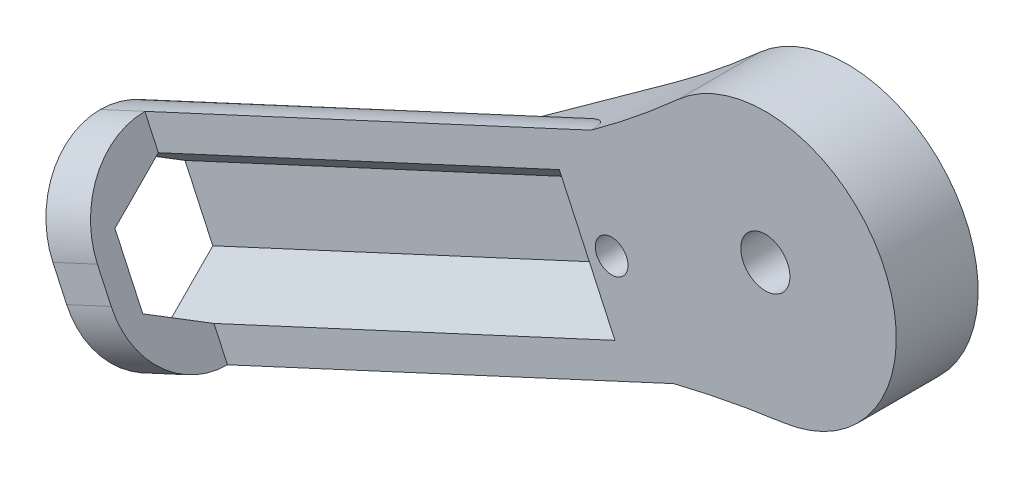
from build123d import *

# Parameters (mm, degrees)
ESQUISSE1_R             = 1.5
ESQUISSE1_R_2           = 1
BOSS_EXTRU_1_DEPTH      = 5
ENL_V_MAT_EXTRU_1_DEPTH = 5
ESQUISSE5_W             = 5
ESQUISSE5_H             = 12
BOSS_EXTRU_2_DEPTH      = 30
CONG_3_START            = -20.022088667
CONG_3_DEPTH            = 7.142932423
CONG_3_START_2          = -12.879156244
CONG_3_2_DEPTH          = 25.906077345
CONG_3_3_OUTLINE_R      = 1
CONG_3_3_OUTLINE_R_2    = 1.5
CONG_3_3_DEPTH          = 5
CONG_4_START            = -20.022088667
CONG_4_DEPTH            = 30
CONG_4_2_DEPTH          = 7.14293242
CONG_4_START_2          = -12.879156247
CONG_4_3_DEPTH          = 25.906077346
CONG_4_4_OUTLINE_R      = 1
CONG_4_4_OUTLINE_R_2    = 1.5
CONG_4_4_DEPTH          = 5
ENL_V_START             = -27
ENL_V_MAT_EXTRU_2_DEPTH = 27
ENL_V_MAT_EXTRU_3_DEPTH = 30


with BuildPart() as part:
    # Esquisse1 → Boss.-Extru.1 (new body)
    with BuildSketch(Plane.XY):
        with BuildLine():
            Line((-22.897983435, -17.234182679), (14.345633901, 0.026586982))
            add(Edge.make_bspline(
                [(14.345633901, 0.026586982), (16.492281726, 0.559482648), (18.723148816, 0.988675042), (21.041646725, 1.309858226)],
                knots=[0, 0, 0, 0, 0.141370549, 0.141370549, 0.141370549, 0.141370549], degree=3))
            ThreePointArc((21.041646725, 1.309858226), (27.202255265, 12.598116604), (14.60702072, 15.193871131))
            add(Edge.make_bspline(
                [(14.60702072, 15.193871131), (12.863335774, 13.632412198), (11.093879733, 12.207631723), (9.299732983, 10.914143371)],
                knots=[0, 0, 0, 0, 0.141370549, 0.141370549, 0.141370549, 0.141370549], degree=3))
            Line((9.299732983, 10.914143371), (-27.943884355, -6.346626291))
            Line((-27.943884355, -6.346626291), (-22.897983435, -17.234182679))
        make_face()
        with Locations((19.943884355, 9.234182671)):
            Circle(ESQUISSE1_R, mode=Mode.SUBTRACT)
        with Locations((10.553366977, 4.882093131)):
            Circle(ESQUISSE1_R_2, mode=Mode.SUBTRACT)
    extrude(amount=BOSS_EXTRU_1_DEPTH)

    # Esquisse2 → Enlèv. mat.-Extru.1 (cut)
    with BuildSketch(Plane.XY.offset(5)):
        Polygon((-53.781292167, 9.271840667), (-26.364947587, 9.271840667), (-1.521431989, -44.333091582), (-53.781292167, -44.333091582), align=None)
    extrude(amount=-ENL_V_MAT_EXTRU_1_DEPTH, mode=Mode.SUBTRACT)

    # Esquisse5 → Boss.-Extru.2 (add)
    with BuildSketch(Plane(origin=(-18.165968268, -8.419122963, 0), x_dir=(0, 0, 1), z_dir=(-0.9072963650485315, -0.42049174304583187, 0))):
        with Locations((7.5, -0.008098332)):
            Rectangle(ESQUISSE5_W, ESQUISSE5_H)
    extrude(amount=-BOSS_EXTRU_2_DEPTH)

    # Congé3: read off the stored shape, not the designer's step
    # Congé3 outline → Congé3 (cut)
    with BuildSketch(Plane(origin=(0, 0, 0), x_dir=(-0.4204917430458318, 0.9072963650485315, 0), z_dir=(0.9072963650485315, 0.4204917430458318, 0)).offset(CONG_3_START)):
        with BuildLine():
            Line((5.991901676, 0), (5.991901676, 5))
            ThreePointArc((5.991901676, 5), (4.527435582, 1.464466094), (0.991901676, 0))
            Line((0.991901676, 0), (5.991901676, 0))
        make_face()
    extrude(amount=CONG_3_DEPTH, mode=Mode.SUBTRACT)

    # Cong_3 2 outline → Cong_3 2 (cut)
    with BuildSketch(Plane(origin=(0, 0, 0), x_dir=(-0.4204917430458318, 0.9072963650485315, 0), z_dir=(0.9072963650485315, 0.4204917430458318, 0)).offset(CONG_3_START_2)):
        with BuildLine():
            Line((5.991901676, 0), (5.991901676, 5))
            ThreePointArc((5.991901676, 5), (4.527435582, 1.464466094), (0.991901676, 0))
            Line((0.991901676, 0), (5.991901676, 0))
        make_face()
    extrude(amount=CONG_3_2_DEPTH, mode=Mode.SUBTRACT)

    # Cong_3 3 outline → Cong_3 3 (add)
    with BuildSketch(Plane.XY):
        with BuildLine():
            Line((-18.583054733, -7.519174178), (-15.639612528, -13.870248741))
            Line((-15.639612528, -13.870248741), (14.345633901, 0.026586982))
            add(Edge.make_bspline(
                [(14.345633901, 0.026586982), (16.492281726, 0.559482648), (18.723148816, 0.988675042), (21.041646725, 1.309858226)],
                knots=[0, 0, 0, 0, 0.141370549, 0.141370549, 0.141370549, 0.141370549], degree=3))
            ThreePointArc((21.041646725, 1.309858226), (27.202255265, 12.598116604), (14.60702072, 15.193871131))
            add(Edge.make_bspline(
                [(14.60702072, 15.193871131), (12.863335774, 13.632412198), (11.093879733, 12.207631723), (9.299732983, 10.914143371), (2.165722649, 5.77088557), (-4.968287685, 0.62762777), (-12.102298019, -4.515630031)],
                knots=[0, 0, 0, 0, 0.141370549, 0.141370549, 0.141370549, 0.703497896, 0.703497896, 0.703497896, 0.703497896], degree=3))
            Line((-12.102298019, -4.515630031), (-18.583054733, -7.519174178))
        make_face()
        with Locations((10.553366977, 4.882093131)):
            Circle(CONG_3_3_OUTLINE_R, mode=Mode.SUBTRACT)
        with Locations((19.943884355, 9.234182671)):
            Circle(CONG_3_3_OUTLINE_R_2, mode=Mode.SUBTRACT)
    extrude(amount=CONG_3_3_DEPTH)

    # Congé4: read off the stored shape, not the designer's step
    # Congé4 outline → Congé4 (cut)
    with BuildSketch(Plane(origin=(0, 0, 0), x_dir=(-0.4204917430458318, 0.9072963650485315, 0), z_dir=(0.9072963650485315, 0.4204917430458318, 0)).offset(CONG_4_START)):
        with BuildLine():
            ThreePointArc((-6.008098332, 5), (-4.543632238, 8.535533906), (-1.008098332, 10))
            Line((-1.008098332, 10), (-6.008098332, 10))
            Line((-6.008098332, 10), (-6.008098332, 5))
        make_face()
        with BuildLine():
            ThreePointArc((0.991901676, 10), (4.527435582, 8.535533906), (5.991901676, 5))
            Line((5.991901676, 5), (5.991901676, 10))
            Line((5.991901676, 10), (0.991901676, 10))
        make_face()
    extrude(amount=CONG_4_DEPTH, mode=Mode.SUBTRACT)

    # Cong_4 2 outline → Cong_4 2 (cut)
    with BuildSketch(Plane(origin=(0, 0, 0), x_dir=(-0.4204917430458318, 0.9072963650485315, 0), z_dir=(0.9072963650485315, 0.4204917430458318, 0)).offset(CONG_4_START)):
        with BuildLine():
            ThreePointArc((-1.008098332, 0), (-4.543632238, 1.464466094), (-6.008098332, 5))
            Line((-6.008098332, 5), (-6.008098332, 0))
            Line((-6.008098332, 0), (-1.008098332, 0))
        make_face()
    extrude(amount=CONG_4_2_DEPTH, mode=Mode.SUBTRACT)

    # Cong_4 3 outline → Cong_4 3 (cut)
    with BuildSketch(Plane(origin=(0, 0, 0), x_dir=(-0.42049174304583214, 0.9072963650485313, 0), z_dir=(0.9072963650485314, 0.42049174304583214, 0)).offset(CONG_4_START_2)):
        with BuildLine():
            ThreePointArc((-1.008098332, 0), (-4.543632238, 1.464466094), (-6.008098332, 5))
            Line((-6.008098332, 5), (-6.008098332, 0))
            Line((-6.008098332, 0), (-1.008098332, 0))
        make_face()
    extrude(amount=CONG_4_3_DEPTH, mode=Mode.SUBTRACT)

    # Cong_4 4 outline → Cong_4 4 (add)
    with BuildSketch(Plane.XY):
        with BuildLine():
            Line((-17.742071243, -9.333766915), (-11.261314532, -6.330222769))
            add(Edge.make_bspline(
                [(-11.261314532, -6.330222769), (-2.725665054, -4.211286186), (5.809984423, -2.092349602), (14.345633901, 0.026586982), (16.492281726, 0.559482648), (18.723148816, 0.988675042), (21.041646725, 1.309858226)],
                knots=[-0.562127348, -0.562127348, -0.562127348, -0.562127348, 0, 0, 0, 0.141370549, 0.141370549, 0.141370549, 0.141370549], degree=3))
            ThreePointArc((21.041646725, 1.309858226), (27.202255265, 12.598116604), (14.60702072, 15.193871131))
            add(Edge.make_bspline(
                [(14.60702072, 15.193871131), (12.863335774, 13.632412198), (11.093879733, 12.207631723), (9.299732983, 10.914143371), (2.165722649, 5.77088557), (-4.968287685, 0.62762777), (-12.102298019, -4.515630031)],
                knots=[0, 0, 0, 0, 0.141370549, 0.141370549, 0.141370549, 0.703497896, 0.703497896, 0.703497896, 0.703497896], degree=3))
            Line((-12.102298019, -4.515630031), (-18.583054733, -7.519174178))
            Line((-18.583054733, -7.519174178), (-17.742071243, -9.333766915))
        make_face()
        with Locations((10.553366977, 4.882093131)):
            Circle(CONG_4_4_OUTLINE_R, mode=Mode.SUBTRACT)
        with Locations((19.943884355, 9.234182671)):
            Circle(CONG_4_4_OUTLINE_R_2, mode=Mode.SUBTRACT)
    extrude(amount=CONG_4_4_DEPTH)

    # Esquisse7 → Enlèv. mat.-Extru.2 (cut)
    with BuildSketch(Plane(origin=(9.052922683, 4.195629328, 0), x_dir=(0, 0, -1), z_dir=(0.9072963650485316, 0.42049174304583187, 0)).offset(ENL_V_START)):
        with BuildLine():
            Line((-10, 0.991901676), (-10, -1.008098332))
            ThreePointArc((-10, -1.008098332), (-8.535533906, -4.543632238), (-5, -6.008098332))
            Line((-5, -6.008098332), (-5, 5.991901668))
            ThreePointArc((-5, 5.991901668), (-8.5355339, 4.527435576), (-10, 0.991901676))
        make_face()
    extrude(amount=ENL_V_MAT_EXTRU_2_DEPTH, mode=Mode.SUBTRACT)

    # Esquisse9 → Enlèv. mat.-Extru.3 (cut)
    with BuildSketch(Plane(origin=(-18.165968268, -8.419122963, 0), x_dir=(0, 0, 1), z_dir=(-0.9072963650485315, -0.42049174304583187, 0))):
        Polygon((1.5, -2.028824274), (5, -4.049550216), (8.5, -2.028824274), (8.5, 2.01262761), (5, 4.033353552), (1.5, 2.01262761), align=None)
    extrude(amount=-ENL_V_MAT_EXTRU_3_DEPTH, mode=Mode.SUBTRACT)


solid = part.part
